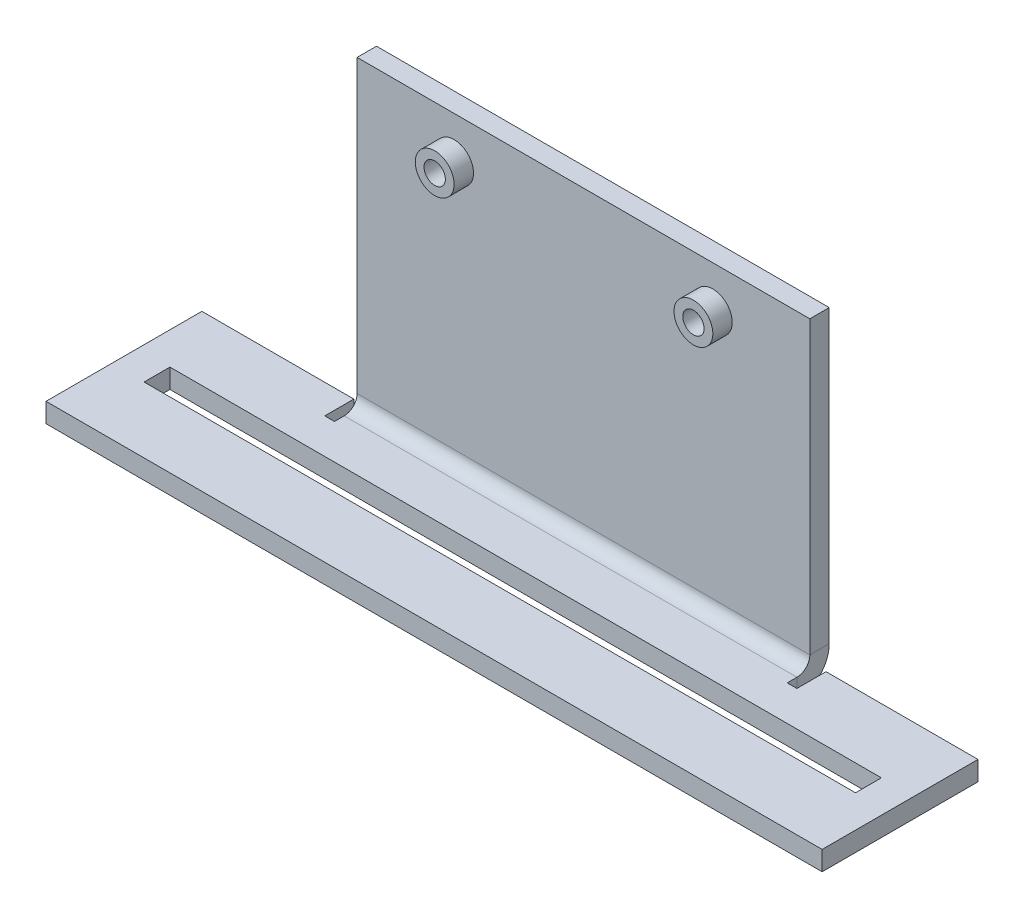
from build123d import *

# Parameters (mm, degrees)
SM_BASE_FLANGE_2_DEPTH            = 3
SM_EDGE_FLANGE_2_STRIP_W          = 16
SM_EDGE_FLANGE_2_STRIP_H          = 3
SM_EDGE_FLANGE_2_STRIP_CUT_DEPTH  = 70
SM_EDGE_FLANGE_2_RELIEF_W         = 17.5
SM_EDGE_FLANGE_2_RELIEF_H         = 1.5
SM_EDGE_FLANGE_2_RELIEF_CUT_DEPTH = 3
SM_EDGE_FLANGE_2_DEPTH            = 70
SKETCH_21_W                       = 110
SKETCH_21_H                       = 4
CUT_EXTRUDE_1_DEPTH               = 30
SKETCH_23_R                       = 3
EXTRUDE_1_DEPTH                   = 3
SKETCH_24_R                       = 1.65
CUT_EXTRUDE_2_DEPTH               = 6


# Sheet-metal steps are written as plain solids
with BuildPart() as part:
    # 草图15 → 基体-法兰2 (new body)
    with BuildSketch(Plane(origin=(0, 0, 0), x_dir=(1, 0, 0), z_dir=(0, 1, 0))):
        Polygon((0, -41.752065), (120, -41.752065), (120, -17.652065), (95, -17.652065), (95, -15.652065), (25, -15.652065), (25, -17.652065), (0, -17.652065), align=None)
    extrude(amount=-SM_BASE_FLANGE_2_DEPTH)

    # 边线-法兰2 strip (across the edge) → 边线-法兰2 strip cut (cut)
    with BuildSketch(Plane(origin=(95, 0, 15.652065), x_dir=(0, 0, 1), z_dir=(-1, 0, 0))):
        with Locations((-3, -1.5)):
            Rectangle(SM_EDGE_FLANGE_2_STRIP_W, SM_EDGE_FLANGE_2_STRIP_H)
    extrude(amount=SM_EDGE_FLANGE_2_STRIP_CUT_DEPTH, mode=Mode.SUBTRACT)

    # 边线-法兰2 relief (on the sheet) → 边线-法兰2 relief cut (cut)
    with BuildSketch(Plane(origin=(95, 0, 20.652065), x_dir=(0, 0, 1), z_dir=(0, 1, 0))):
        with Locations((-7.25, 0.75)):
            Rectangle(SM_EDGE_FLANGE_2_RELIEF_W, SM_EDGE_FLANGE_2_RELIEF_H)
        with Locations((-7.25, -70.75)):
            Rectangle(SM_EDGE_FLANGE_2_RELIEF_W, SM_EDGE_FLANGE_2_RELIEF_H)
    extrude(amount=-SM_EDGE_FLANGE_2_RELIEF_CUT_DEPTH, mode=Mode.SUBTRACT)

    # 边线-法兰2 section (across the edge) → 边线-法兰2 (add)
    with BuildSketch(Plane(origin=(95, 0, 15.652065), x_dir=(0, 0, 1), z_dir=(-1, 0, 0))):
        with BuildLine():
            Line((0, 2), (0, 47))
            Line((0, 47), (3, 47))
            Line((3, 47), (3, 2))
            ThreePointArc((3, 2), (3.585786438, 0.585786438), (5, 0))
            Line((5, 0), (5, -3))
            ThreePointArc((5, -3), (1.464466094, -1.535533906), (0, 2))
        make_face()
    extrude(amount=SM_EDGE_FLANGE_2_DEPTH)

    # 草图21 → 切除-拉伸1 (cut)
    with BuildSketch(Plane(origin=(0, 0, 0), x_dir=(1, 0, 0), z_dir=(0, 1, 0))):
        with Locations((60, -29.58826484)):
            Rectangle(SKETCH_21_W, SKETCH_21_H)
    extrude(amount=-CUT_EXTRUDE_1_DEPTH, mode=Mode.SUBTRACT)

    # 草图23 → 凸台-拉伸1 (add)
    with BuildSketch(Plane.XY.offset(18.652065)):
        with Locations((40, 40.5)):
            Circle(SKETCH_23_R)
        with Locations(Location((80, 40.5, 0), (0, 0, 180))):
            Circle(SKETCH_23_R)
    extrude(amount=EXTRUDE_1_DEPTH)

    # 草图24 → 切除-拉伸2 (cut)
    with BuildSketch(Plane.XY.offset(21.652065)):
        with Locations((40, 40.5)):
            Circle(SKETCH_24_R)
        with Locations((80, 40.5)):
            Circle(SKETCH_24_R)
    extrude(amount=-CUT_EXTRUDE_2_DEPTH, mode=Mode.SUBTRACT)


solid = part.part
